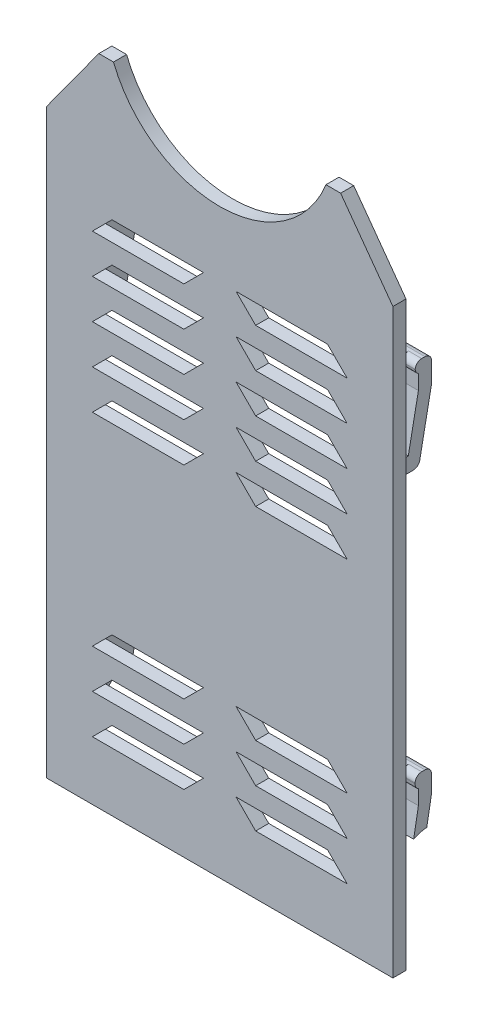
from build123d import *

# Parameters (mm, degrees)
BOSS_EXTRU_1_DEPTH      = 2
BOSS_EXTRU_3_START      = -53
BOSS_EXTRU_3_DEPTH      = 53.000012
ENL_V_MAT_EXTRU_1_REACH = 228.086
BOSS_EXTRU_4_START      = -3.5
BOSS_EXTRU_4_DEPTH      = 3
BOSS_EXTRU_5_START      = -49.5
BOSS_EXTRU_5_DEPTH      = 3
BOSS_EXTRU_6_START      = -6.499983
BOSS_EXTRU_6_DEPTH      = 3.000004
BOSS_EXTRU_7_START      = -49.5
BOSS_EXTRU_7_DEPTH      = 3
ENL_V_MAT_EXTRU_4_REACH = 228.029
CONG_1_START            = -218.722210076
CONG_1_DEPTH            = 2
CONG_1_START_2          = -170.722192301
CONG_1_2_DEPTH          = 1.999982225
CONG_1_START_3          = -170.722210076
CONG_1_3_DEPTH          = 0.188775796
CONG_3_R                = 1
ENL_V_MAT_EXTRU_3_DEPTH = 227.085814543
ENL_V_START             = -5.4
ESQUISSE8_W             = 57.405681666
ESQUISSE8_H             = 8.808279197
ENL_V_MAT_EXTRU_6_DEPTH = 5.4
CONG_5_R                = 5


with BuildPart() as part:
    # Esquisse1 → Boss.-Extru.1 (new body)
    with BuildSketch(Plane.XY.offset(87.363371848)):
        with BuildLine():
            Line((-209.977886558, 50.618314147), (-212.222210076, 50.618314147))
            Line((-212.222210076, 50.618314147), (-220.222210076, 39.599284914))
            Line((-220.222210076, 39.599284914), (-220.222210076, -49.381685853))
            Line((-220.222210076, -49.381685853), (-167.222210076, -49.381685853))
            Line((-167.222210076, -49.381685853), (-167.222210076, 39.599284914))
            Line((-167.222210076, 39.599284914), (-175.222210076, 50.618314147))
            Line((-175.222210076, 50.618314147), (-177.466533593, 50.618314147))
            ThreePointArc((-177.466533593, 50.618314147), (-193.722210076, 39.599284914), (-209.977886558, 50.618314147))
        make_face()
    extrude(amount=BOSS_EXTRU_1_DEPTH)

    # Esquisse2 → Boss.-Extru.3 (add)
    with BuildSketch(Plane(origin=(-167.222210076, 0, 0), x_dir=(0, 0, -1), z_dir=(1, 0, 0)).offset(BOSS_EXTRU_3_START)):
        Polygon((-83.963371848, 25.004241463), (-85.510615846, 17.118314147), (-87.363371848, 17.118314147), (-87.363371848, 14.846338453), (-83.918252525, 14.846338453), (-81.963371848, 24.809891037), (-81.963371848, 29.004241463), (-84.463371848, 29.004241463), (-84.463371848, 27.267232592), (-83.963371848, 27.267232592), align=None)
        Polygon((-87.363371848, -39.881685853), (-87.363371848, -37.881685853), (-85.363371848, -37.881685853), (-83.963371848, -29.995758537), (-83.963371848, -27.750975606), (-84.463371848, -27.750975606), (-84.463371848, -25.750975606), (-81.963371848, -25.750975606), (-81.963371848, -29.464435342), (-83.81276129, -39.881685853), align=None)
    extrude(amount=BOSS_EXTRU_3_DEPTH)

    # Enlèv. mat.-Extru.1: up to this face of the body (flat: up to its plane)
    enl_v_mat_extru_1_end = Plane(part.part.faces().sort_by_distance((-193.722210076, 30.844149197, 87.363371848))[0])
    # Esquisse4 → Enlèv. mat.-Extru.1 (cut, up to the picked face)
    with BuildSketch(Plane(origin=(0, 0, 81.963371848), x_dir=(-1, 0, 0), z_dir=(0, 0, -1)), mode=Mode.PRIVATE) as enl_v_mat_extru_1_sk1:
        Polygon((170.722207248, 29.004241463), (216.722210076, 29.004241463), (216.722210076, -45.719527558), (170.722187305, -45.719527558), align=None)
    enl_v_mat_extru_1_tool1 = split(extrude(enl_v_mat_extru_1_sk1.sketch, amount=-ENL_V_MAT_EXTRU_1_REACH, mode=Mode.PRIVATE), bisect_by=enl_v_mat_extru_1_end, keep=Keep.BOTH, mode=Mode.PRIVATE)
    add(enl_v_mat_extru_1_tool1.solids().sort_by(Axis((-193.722204, -8.357646, 81.963372), (0, 0, 1)))[0], mode=Mode.SUBTRACT)


with BuildPart() as boss_extru_4_tool:
    # Esquisse2<4> → Boss.-Extru.4 (new body)
    with BuildSketch(Plane(origin=(-167.222210076, 0, 0), x_dir=(0, 0, -1), z_dir=(1, 0, 0)).offset(BOSS_EXTRU_4_START)):
        Polygon((-81.963371848, 29.004241463), (-88.413322327, 29.004241463), (-88.741836901, 17.118314147), (-88.741836901, 14.846338453), (-83.918252525, 14.846338453), (-81.963371848, 24.809891037), align=None)
    extrude(amount=-BOSS_EXTRU_4_DEPTH)


with BuildPart() as part_1:
    add(part.part)


with BuildPart() as part_2:
    # Boss.-Extru.4: joined with boss_extru_4_tool
    add(part_1.part.fuse(boss_extru_4_tool.part, tol=0.00001))

    # Esquisse2<5> → Boss.-Extru.5 (add)
    with BuildSketch(Plane(origin=(-167.222210076, 0, 0), x_dir=(0, 0, -1), z_dir=(1, 0, 0)).offset(BOSS_EXTRU_5_START)):
        Polygon((-87.363371848, 17.118314147), (-85.510615846, 17.118314147), (-83.963371848, 25.004241463), (-83.963371848, 27.267232592), (-84.463371848, 27.267232592), (-84.463371848, 29.004241463), (-87.363371848, 29.004241463), align=None)
        Polygon((-83.963371848, 25.004241463), (-85.510615846, 17.118314147), (-87.363371848, 17.118314147), (-87.363371848, 14.846338453), (-83.918252525, 14.846338453), (-81.963371848, 24.809891037), (-81.963371848, 29.004241463), (-84.463371848, 29.004241463), (-84.463371848, 27.267232592), (-83.963371848, 27.267232592), align=None)
    extrude(amount=BOSS_EXTRU_5_DEPTH)

    # Esquisse2<6> → Boss.-Extru.6 (add)
    with BuildSketch(Plane(origin=(-167.222210076, 0, 0), x_dir=(0, 0, -1), z_dir=(1, 0, 0)).offset(BOSS_EXTRU_6_START)):
        Polygon((-83.963371848, 25.004241463), (-85.510615846, 17.118314147), (-87.363371848, 17.118314147), (-88.741836901, 17.118314147), (-88.741836901, 14.846338453), (-83.918252525, 14.846338453), (-81.963371848, 24.809891037), (-81.963371848, 29.004241463), (-84.463371848, 29.004241463), (-84.463371848, 27.267232592), (-83.963371848, 27.267232592), align=None)
        Polygon((-87.363371848, 17.118314147), (-85.510615846, 17.118314147), (-83.963371848, 25.004241463), (-83.963371848, 27.267232592), (-84.463371848, 27.267232592), (-84.463371848, 29.004241463), (-88.413322327, 29.004241463), (-88.741836901, 17.118314147), align=None)
        Polygon((-83.963371848, -29.995758537), (-83.963371848, -27.750975606), (-84.463371848, -27.750975606), (-84.463371848, -25.750975606), (-87.363371848, -25.750975606), (-87.363371848, -37.881685853), (-85.363371848, -37.881685853), align=None)
        Polygon((-84.463371848, -27.750975606), (-83.963371848, -27.750975606), (-83.963371848, -29.995758537), (-85.363371848, -37.881685853), (-87.363371848, -37.881685853), (-87.363371848, -39.881685853), (-83.81276129, -39.881685853), (-81.963371848, -29.464435342), (-81.963371848, -25.750975606), (-84.463371848, -25.750975606), align=None)
    extrude(amount=BOSS_EXTRU_6_DEPTH)

    # Esquisse2<9> → Boss.-Extru.7 (add)
    with BuildSketch(Plane(origin=(-167.222210076, 0, 0), x_dir=(0, 0, -1), z_dir=(1, 0, 0)).offset(BOSS_EXTRU_7_START)):
        Polygon((-84.463371848, -25.750975606), (-87.363371848, -25.750975606), (-87.363371848, -37.881685853), (-85.363371848, -37.881685853), (-83.963371848, -29.995758537), (-83.963371848, -27.750975606), (-84.463371848, -27.750975606), align=None)
        Polygon((-81.963371848, -25.750975606), (-84.463371848, -25.750975606), (-84.463371848, -27.750975606), (-83.963371848, -27.750975606), (-83.963371848, -29.995758537), (-85.363371848, -37.881685853), (-87.363371848, -37.881685853), (-87.363371848, -39.881685853), (-83.81276129, -39.881685853), (-81.963371848, -29.464435342), align=None)
    extrude(amount=BOSS_EXTRU_7_DEPTH)

    # Enlèv. mat.-Extru.4: up to this face of the body (flat: up to its plane)
    enl_v_mat_extru_4_end = Plane(part_2.part.faces().sort_by_distance((-170.472204076, 26.90706625, 81.963371848))[0])
    # Esquisse7 → Enlèv. mat.-Extru.4 (cut, up to the picked face)
    with BuildSketch(Plane(origin=(0, 0, 87.363371848), x_dir=(-1, 0, 0), z_dir=(0, 0, -1)), mode=Mode.PRIVATE) as enl_v_mat_extru_4_sk1:
        Polygon((168.722210076, 33.372292481), (168.722210076, -47.881685853), (218.722210076, -47.881685853), (218.722210076, 33.372292481), (220.222210076, 33.372292481), (220.222210076, -49.381685853), (167.222210076, -49.381685853), (167.222208414, 33.372292481), align=None)
    enl_v_mat_extru_4_tool1 = split(extrude(enl_v_mat_extru_4_sk1.sketch, amount=ENL_V_MAT_EXTRU_4_REACH, mode=Mode.PRIVATE), bisect_by=enl_v_mat_extru_4_end, keep=Keep.BOTH, mode=Mode.PRIVATE)
    add(enl_v_mat_extru_4_tool1.solids().sort_by(Axis((-167.739498, -7.254697, 87.363372), (0, 0, -1)))[0], mode=Mode.SUBTRACT)


with BuildPart() as enl_v_mat_extru_4_kept_piece:
    # of the separate pieces the step leaves, the one the design keeps (enl_v_mat_extru_4_pieces_kept)
    add(part_2.part.solids().sort_by_distance((-209.977886558, 50.618314147, 87.363371848))[0])

    # Congé1: read off the stored shape, not the designer's step
    # Congé1 outline → Congé1 (cut)
    with BuildSketch(Plane.YZ.offset(CONG_1_START)):
        with BuildLine():
            Line((-27.750975606, 84.463371848), (-27.750975606, 83.963371848))
            ThreePointArc((-27.750975606, 83.963371848), (-27.384950202, 84.329397252), (-26.884950202, 84.463371848))
            Line((-26.884950202, 84.463371848), (-27.750975606, 84.463371848))
        make_face()
        with BuildLine():
            Line((-25.750975606, 84.463371848), (-26.750975606, 84.463371848))
            ThreePointArc((-26.750975606, 84.463371848), (-26.043868825, 84.170478629), (-25.750975606, 83.463371848))
            Line((-25.750975606, 83.463371848), (-25.750975606, 84.463371848))
        make_face()
        with BuildLine():
            ThreePointArc((28.06874973, 84.461289021), (28.733798955, 84.147291337), (29.004241463, 83.463371848))
            Line((29.004241463, 83.463371848), (29.004241463, 84.463371848))
            Line((29.004241463, 84.463371848), (27.267232592, 84.463371848))
            Line((27.267232592, 84.463371848), (27.267232592, 83.963371848))
            ThreePointArc((27.267232592, 83.963371848), (27.605570962, 84.312810718), (28.06874973, 84.461289021))
        make_face()
    extrude(amount=CONG_1_DEPTH, mode=Mode.SUBTRACT)

    # Cong_1 2 outline → Cong_1 2 (cut)
    with BuildSketch(Plane.YZ.offset(CONG_1_START_2)):
        with BuildLine():
            Line((-27.750975606, 84.463371848), (-27.750975606, 83.963371848))
            ThreePointArc((-27.750975606, 83.963371848), (-27.384950202, 84.329397252), (-26.884950202, 84.463371848))
            Line((-26.884950202, 84.463371848), (-27.750975606, 84.463371848))
        make_face()
        with BuildLine():
            Line((-25.750975606, 84.463371848), (-26.750975606, 84.463371848))
            ThreePointArc((-26.750975606, 84.463371848), (-26.043868825, 84.170478629), (-25.750975606, 83.463371848))
            Line((-25.750975606, 83.463371848), (-25.750975606, 84.463371848))
        make_face()
        with BuildLine():
            ThreePointArc((28.06874973, 84.461289021), (28.733798955, 84.147291337), (29.004241463, 83.463371848))
            Line((29.004241463, 83.463371848), (29.004241463, 84.463371848))
            Line((29.004241463, 84.463371848), (27.267232592, 84.463371848))
            Line((27.267232592, 84.463371848), (27.267232592, 83.963371848))
            ThreePointArc((27.267232592, 83.963371848), (27.605570962, 84.312810718), (28.06874973, 84.461289021))
        make_face()
    extrude(amount=CONG_1_2_DEPTH, mode=Mode.SUBTRACT)

    # Cong_1 3 outline → Cong_1 3 (cut)
    with BuildSketch(Plane.YZ.offset(CONG_1_START_3)):
        with BuildLine():
            ThreePointArc((28.06874973, 84.461289021), (28.733798955, 84.147291337), (29.004241463, 83.463371848))
            Line((29.004241463, 83.463371848), (29.004241463, 84.463371848))
            Line((29.004241463, 84.463371848), (27.267232592, 84.463371848))
            Line((27.267232592, 84.463371848), (27.267232592, 83.963371848))
            ThreePointArc((27.267232592, 83.963371848), (27.605570962, 84.312810718), (28.06874973, 84.461289021))
        make_face()
    extrude(amount=CONG_1_3_DEPTH, mode=Mode.SUBTRACT)

    # Congé3
    cong_3_edges = [enl_v_mat_extru_4_kept_piece.edges().sort_by_distance(p)[0] for p in [
        (-171.222210076, 29.004241463, 81.963371848),
        (-171.222210076, 14.846338453, 83.918252525),
        (-171.222201576, -39.881685853, 83.81276129),
        (-171.222201576, -25.750975606, 81.963371848),
        (-216.222210076, 29.004241463, 81.963371848),
        (-216.222210076, 14.846338453, 83.918252525),
        (-216.222210076, -39.881685853, 83.81276129),
        (-216.222210076, -25.750975606, 81.963371848),
    ]]
    fillet(cong_3_edges, radius=CONG_3_R)

    # Esquisse6 → Enlèv. mat.-Extru.3 (cut, through all)
    with BuildSketch(Plane.XY.offset(89.363371848)):
        Polygon((-191.222210076, 29.599284914), (-177.222210076, 29.599284914), (-174.222210076, 26.599284914), (-188.222210076, 26.599284914), align=None)
        Polygon((-191.222210076, -31.400715086), (-177.222210076, -31.400715086), (-174.222210076, -34.400715086), (-188.222210076, -34.400715086), align=None)
        Polygon((-191.222210076, 23.599284914), (-177.222210076, 23.599284914), (-174.222210076, 20.599284914), (-188.222210076, 20.599284914), align=None)
        Polygon((-191.222210076, 17.599284914), (-177.222210076, 17.599284914), (-174.222210076, 14.599284914), (-188.222210076, 14.599284914), align=None)
        Polygon((-191.222210076, 11.599284914), (-177.222210076, 11.599284914), (-174.222210076, 8.599284914), (-188.222210076, 8.599284914), align=None)
        Polygon((-191.222210076, 5.599284914), (-177.222210076, 5.599284914), (-174.222210076, 2.599284914), (-188.222210076, 2.599284914), align=None)
        Polygon((-191.222210076, -25.400715086), (-177.222210076, -25.400715086), (-174.222210076, -28.400715086), (-188.222210076, -28.400715086), align=None)
        Polygon((-191.222210076, -37.400715086), (-177.222210076, -37.400715086), (-174.222210076, -40.400715086), (-188.222210076, -40.400715086), align=None)
        Polygon((-210.207786747, 29.599284914), (-213.207786747, 26.599284914), (-199.207786747, 26.599284914), (-196.207786747, 29.599284914), align=None)
        Polygon((-196.207786747, -37.400715086), (-199.207786747, -40.400715086), (-213.207786747, -40.400715086), (-210.207786747, -37.400715086), align=None)
        Polygon((-196.207786747, -31.400715086), (-199.207786747, -34.400715086), (-213.207786747, -34.400715086), (-210.207786747, -31.400715086), align=None)
        Polygon((-196.207786747, 5.599284914), (-199.207786747, 2.599284914), (-213.207786747, 2.599284914), (-210.207786747, 5.599284914), align=None)
        Polygon((-196.207786747, 11.599284914), (-199.207786747, 8.599284914), (-213.207786747, 8.599284914), (-210.207786747, 11.599284914), align=None)
        Polygon((-196.207786747, 17.599284914), (-199.207786747, 14.599284914), (-213.207786747, 14.599284914), (-210.207786747, 17.599284914), align=None)
        Polygon((-196.207786747, 23.599284914), (-199.207786747, 20.599284914), (-213.207786747, 20.599284914), (-210.207786747, 23.599284914), align=None)
        Polygon((-196.207786747, -25.400715086), (-199.207786747, -28.400715086), (-213.207786747, -28.400715086), (-210.207786747, -25.400715086), align=None)
    extrude(amount=-ENL_V_MAT_EXTRU_3_DEPTH, mode=Mode.SUBTRACT)

    # Esquisse8 → Enlèv. mat.-Extru.6 (cut)
    with BuildSketch(Plane(origin=(0, 0, 81.963371848), x_dir=(-1, 0, 0), z_dir=(0, 0, -1)).offset(ENL_V_START)):
        with Locations((193.926049586, -37.922540866)):
            Rectangle(ESQUISSE8_W, ESQUISSE8_H)
    extrude(amount=ENL_V_MAT_EXTRU_6_DEPTH, mode=Mode.SUBTRACT)

    # Congé5
    # the kernel refuses this fillet: 5 mm, written as the material it adds along each edge
    with BuildSketch(Plane(origin=(-170.722189076, -33.518401267, 87.363371848), x_dir=(0, -1, 0), z_dir=(-1, 0, 0))) as cong_5_piece_1:
        with BuildLine():
            CenterArc((4.989768314, -5), CONG_5_R, 90, 86.333933602)
            Line((0, -4.680293608), (0, 0))
            Line((0, 0), (4.989768314, 0))
        make_face()
    extrude(amount=3.000004)
    with BuildSketch(Plane(origin=(-158.247768292, -33.518401267, 87.363371848), x_dir=(0, -1, 0), z_dir=(-1, 0, 0))) as cong_5_piece_2_section:
        with BuildLine():
            CenterArc((4.989768314, -5), CONG_5_R, 90, 86.333933602)
            Line((0, -4.680293608), (0, 0))
            Line((0, 0), (4.989768314, 0))
        make_face()
    cong_5_piece_2 = extrude(amount=27.948845568, mode=Mode.PRIVATE)
    cong_5_piece_2 = split(cong_5_piece_2, bisect_by=Plane(origin=(-158.247768292, -33.995933007, 84.673528566), z_dir=(0, -0.17479821137928658, -0.9846042785295026)), keep=Keep.TOP, mode=Mode.PRIVATE)
    cong_5_piece_2 = split(cong_5_piece_2, bisect_by=Plane(origin=(-168.722210076, -33.518401267, 87.363371848), z_dir=(-1, 0, 0)), keep=Keep.TOP, mode=Mode.PRIVATE)
    cong_5_piece_2 = split(cong_5_piece_2, bisect_by=Plane(origin=(-170.722189076, -33.518401267, 87.363371848), z_dir=(1, 0, 0)), keep=Keep.TOP, mode=Mode.PRIVATE)
    add(cong_5_piece_2)
    with BuildSketch(Plane(origin=(-213.722210076, -33.518401267, 87.363371848), x_dir=(0, -1, 0), z_dir=(-1, 0, 0))) as cong_5_piece_3:
        with BuildLine():
            CenterArc((4.989768314, -5), CONG_5_R, 90, 86.333933602)
            Line((0, -4.680293608), (0, 0))
            Line((0, 0), (4.989768314, 0))
        make_face()
    extrude(amount=3)
    with BuildSketch(Plane(origin=(-213.722210076, -33.518401267, 87.363371848), x_dir=(0, -1, 0), z_dir=(-1, 0, 0))) as cong_5_piece_4_section:
        with BuildLine():
            CenterArc((4.989768314, -5), CONG_5_R, 90, 86.333933602)
            Line((0, -4.680293608), (0, 0))
            Line((0, 0), (4.989768314, 0))
        make_face()
    cong_5_piece_4 = extrude(amount=15.474420784, mode=Mode.PRIVATE)
    cong_5_piece_4 = split(cong_5_piece_4, bisect_by=Plane(origin=(-213.722210076, -33.995933007, 84.673528566), z_dir=(0, -0.17479821137928658, -0.9846042785295026)), keep=Keep.TOP, mode=Mode.PRIVATE)
    cong_5_piece_4 = split(cong_5_piece_4, bisect_by=Plane(origin=(-218.722210076, -33.518401267, 87.363371848), z_dir=(1, 0, 0)), keep=Keep.TOP, mode=Mode.PRIVATE)
    add(cong_5_piece_4)


solid = enl_v_mat_extru_4_kept_piece.part
